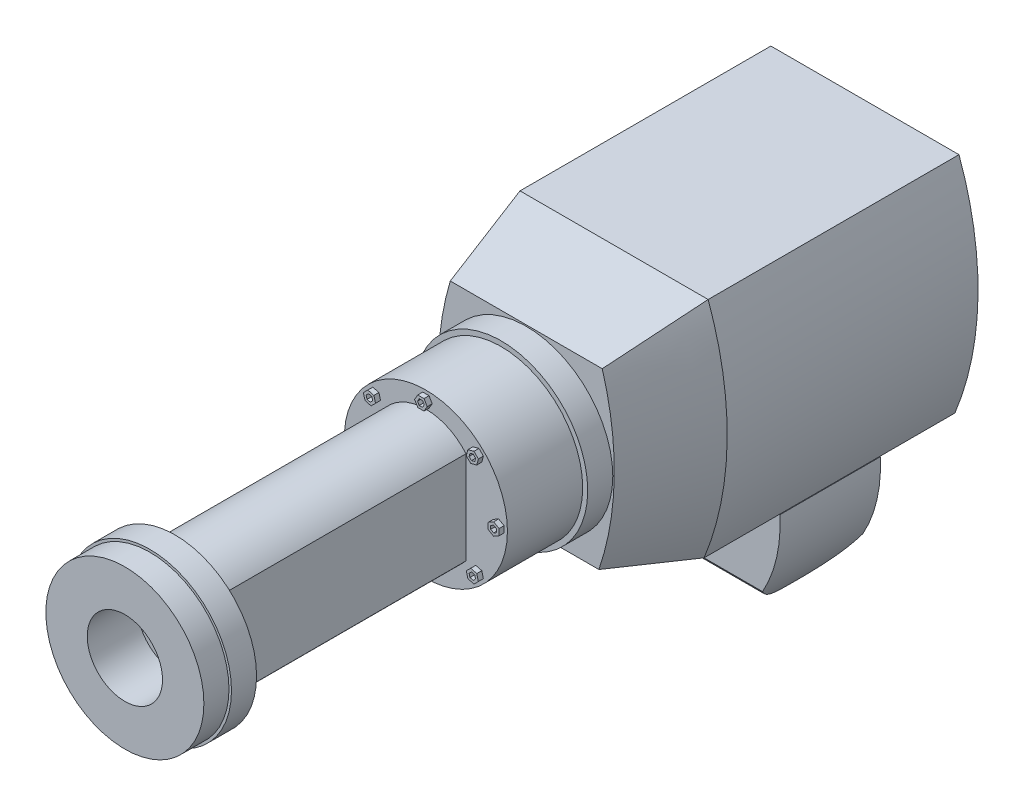
from build123d import *

# Parameters (mm, degrees)
BOSS_EXTRU_1_DEPTH           = 100
ESQUISSE4_R                  = 34.5
BOSS_EXTRU_2_DEPTH           = 10
ESQUISSE5_R                  = 32.5
BOSS_EXTRU_3_DEPTH           = 30
BOSS_EXTRU_4_DEPTH           = 2
R_P_TITION_START             = 175
R_P_TITION_CIRCULAIRE1_DEPTH = 2
BOSS_EXTRU_5_DEPTH           = 100
ESQUISSE8_R                  = 32.5
BOSS_EXTRU_6_DEPTH           = 10
ESQUISSE9_R                  = 31.5
BOSS_EXTRU_7_DEPTH           = 10
BOSS_EXTRU_8_DEPTH           = 21
BOSS_EXTRU_8_DEPTH_BACK      = 18
ESQUISSE11_R                 = 42.5
BOSS_EXTRU_9_DEPTH           = 35
BOSS_EXTRU_10_DEPTH          = 20
BOSS_EXTRU_10_DEPTH_BACK     = 20
ENL_V_MAT_EXTRU_1_DEPTH      = 317.476302481
ESQUISSE15_R                 = 15
ENL_V_MAT_EXTRU_2_DEPTH      = 20
ESQUISSE16_R                 = 15
ENL_V_MAT_EXTRU_3_DEPTH      = 20


# Read off the part's stored shape, not the designer's step: Répétition circulaire1
with BuildPart() as part:
    # Esquisse1 → Boss.-Extru.1 (new body)
    with BuildSketch(Plane.XY):
        with BuildLine():
            Line((-37.5, 45), (37.5, 45))
            ThreePointArc((37.5, 45), (45.075676523, -0.150274002), (35.886541902, -45))
            Line((35.886541902, -45), (-35.886541902, -45))
            ThreePointArc((-35.886541902, -45), (-45.075676523, -0.150274002), (-37.5, 45))
        make_face()
    extrude(amount=BOSS_EXTRU_1_DEPTH)

    # Esquisse2 for Lissage2 → Lissage2 section 0
    with BuildSketch(Plane.XY.offset(100)):
        with BuildLine():
            Line((-35.886541902, -45), (35.886541902, -45))
            # circular arc as an exact rational Bezier (weights 1, cos(half-angle), 1)
            Bezier((35.886541902, -45), (54.060708359, -0.311351473), (37.5, 45), weights=[1, 0.93292998, 1])
            Line((37.5, 45), (-37.5, 45))
            Bezier((-37.5, 45), (-54.060708359, -0.311351473), (-35.886541902, -45), weights=[1, 0.93292998, 1])
        make_face()
    # Esquisse3 for Lissage2 → Lissage2 section 1
    with BuildSketch(Plane.XY.offset(135)):
        with BuildLine():
            Line((30.286276797, 35), (-30.286276797, 35))
            Bezier((-30.286276797, 35), (-40.80320151, -0.213468414), (-28.950299615, -35), weights=[1, 0.952543259, 1])
            Line((-28.950299615, -35), (28.950299615, -35))
            Bezier((28.950299615, -35), (40.80320151, -0.213468414), (30.286276797, 35), weights=[1, 0.952543259, 1])
        make_face()
    loft()

    # Esquisse4 → Boss.-Extru.2 (add)
    with BuildSketch(Plane.XY.offset(135)):
        Circle(ESQUISSE4_R)
    extrude(amount=BOSS_EXTRU_2_DEPTH)

    # Esquisse5 → Boss.-Extru.3 (add)
    with BuildSketch(Plane.XY.offset(145)):
        Circle(ESQUISSE5_R)
    extrude(amount=BOSS_EXTRU_3_DEPTH)

    # Esquisse6 → Boss.-Extru.4 (add)
    with BuildSketch(Plane.XY.offset(175)):
        Polygon((31.165063509, 1.25), (29, 2.5), (26.834936491, 1.25), (26.834936491, -1.25), (29, -2.5), (31.165063509, -1.25), align=None)
        Polygon((29, 1.345299462), (27.834936491, 0.672649731), (27.834936491, -0.672649731), (29, -1.345299462), (30.165063509, -0.672649731), (30.165063509, 0.672649731), align=None, mode=Mode.SUBTRACT)
    extrude(amount=BOSS_EXTRU_4_DEPTH)

    # Répétition circulaire1 outline → Répétition circulaire1 (add)
    # profile 1 of 7: a face of its own
    with BuildSketch(Plane.XY.offset(R_P_TITION_START)):
        Polygon((22.92091122, 21.153144267), (21.153144267, 22.92091122), (18.738329701, 22.273863607), (18.091282089, 19.859049042), (19.859049042, 18.091282089), (22.273863607, 18.738329701), align=None)
        Polygon((19.20663716, 20.157907532), (19.554826282, 21.457367026), (20.854285776, 21.805556148), (21.805556148, 20.854285776), (21.457367026, 19.554826282), (20.157907532, 19.20663716), align=None, mode=Mode.SUBTRACT)
    # profile 2 of 7: a face of its own
    with BuildSketch(Plane.XY.offset(R_P_TITION_START)):
        Polygon((21.153144267, -22.92091122), (22.92091122, -21.153144267), (22.273863607, -18.738329701), (19.859049042, -18.091282089), (18.091282089, -19.859049042), (18.738329701, -22.273863607), align=None)
        Polygon((20.157907532, -19.20663716), (21.457367026, -19.554826282), (21.805556148, -20.854285776), (20.854285776, -21.805556148), (19.554826282, -21.457367026), (19.20663716, -20.157907532), align=None, mode=Mode.SUBTRACT)
    # profile 3 of 7: a face of its own
    with BuildSketch(Plane.XY.offset(R_P_TITION_START)):
        Polygon((-1.25, -31.165063509), (1.25, -31.165063509), (2.5, -29), (1.25, -26.834936491), (-1.25, -26.834936491), (-2.5, -29), align=None)
        Polygon((0.672649731, -27.834936491), (1.345299462, -29), (0.672649731, -30.165063509), (-0.672649731, -30.165063509), (-1.345299462, -29), (-0.672649731, -27.834936491), align=None, mode=Mode.SUBTRACT)
    # profile 4 of 7: a face of its own
    with BuildSketch(Plane.XY.offset(R_P_TITION_START)):
        Polygon((-22.92091122, -21.153144267), (-21.153144267, -22.92091122), (-18.738329701, -22.273863607), (-18.091282089, -19.859049042), (-19.859049042, -18.091282089), (-22.273863607, -18.738329701), align=None)
        Polygon((-19.20663716, -20.157907532), (-19.554826282, -21.457367026), (-20.854285776, -21.805556148), (-21.805556148, -20.854285776), (-21.457367026, -19.554826282), (-20.157907532, -19.20663716), align=None, mode=Mode.SUBTRACT)
    # profile 5 of 7: a face of its own
    with BuildSketch(Plane.XY.offset(R_P_TITION_START)):
        Polygon((-31.165063509, 1.25), (-31.165063509, -1.25), (-29, -2.5), (-26.834936491, -1.25), (-26.834936491, 1.25), (-29, 2.5), align=None)
        Polygon((-27.834936491, -0.672649731), (-29, -1.345299462), (-30.165063509, -0.672649731), (-30.165063509, 0.672649731), (-29, 1.345299462), (-27.834936491, 0.672649731), align=None, mode=Mode.SUBTRACT)
    # profile 6 of 7: a face of its own
    with BuildSketch(Plane.XY.offset(R_P_TITION_START)):
        Polygon((-21.153144267, 22.92091122), (-22.92091122, 21.153144267), (-22.273863607, 18.738329701), (-19.859049042, 18.091282089), (-18.091282089, 19.859049042), (-18.738329701, 22.273863607), align=None)
        Polygon((-20.157907532, 19.20663716), (-21.457367026, 19.554826282), (-21.805556148, 20.854285776), (-20.854285776, 21.805556148), (-19.554826282, 21.457367026), (-19.20663716, 20.157907532), align=None, mode=Mode.SUBTRACT)
    # profile 7 of 7: a face of its own
    with BuildSketch(Plane.XY.offset(R_P_TITION_START)):
        Polygon((1.25, 31.165063509), (-1.25, 31.165063509), (-2.5, 29), (-1.25, 26.834936491), (1.25, 26.834936491), (2.5, 29), align=None)
        Polygon((-0.672649731, 27.834936491), (-1.345299462, 29), (-0.672649731, 30.165063509), (0.672649731, 30.165063509), (1.345299462, 29), (0.672649731, 27.834936491), align=None, mode=Mode.SUBTRACT)
    extrude(amount=R_P_TITION_CIRCULAIRE1_DEPTH)

    # Esquisse7 → Boss.-Extru.5 (add)
    with BuildSketch(Plane.XY.offset(175)):
        with BuildLine():
            Line((16, -18.5), (16, 18.5))
            ThreePointArc((16, 18.5), (0, 25.898529491), (-16, 18.5))
            Line((-16, 18.5), (-16, -18.5))
            ThreePointArc((-16, -18.5), (0, -25.898529491), (16, -18.5))
        make_face()
    extrude(amount=BOSS_EXTRU_5_DEPTH)

    # Esquisse11 → Boss.-Extru.8 (add, two sides: drawn at the far end of the back side and taken through both)
    with BuildSketch(Plane(origin=(-35.886541902, 0, 0), x_dir=(0, 0, -1), z_dir=(1, 0, 0)).offset(-BOSS_EXTRU_8_DEPTH_BACK)):
        with Locations((-50, -45)):
            Circle(ESQUISSE11_R)
    extrude(amount=BOSS_EXTRU_8_DEPTH + BOSS_EXTRU_8_DEPTH_BACK)

    # Esquisse12 → Boss.-Extru.9 (add)
    with BuildSketch(Plane(origin=(-14.886541902, 0, 0), x_dir=(0, 0, -1), z_dir=(1, 0, 0))):
        with BuildLine():
            Line((-70, -45), (-70, -75))
            ThreePointArc((-70, -75), (-50, -85.128852225), (-30, -75))
            Line((-30, -75), (-30, -45))
            Line((-30, -45), (-70, -45))
        make_face()
    extrude(amount=BOSS_EXTRU_9_DEPTH)

    # Esquisse13 → Boss.-Extru.10 (add, two sides: drawn at the far end of the back side and taken through both)
    with BuildSketch(Plane.XY.offset(50).offset(-BOSS_EXTRU_10_DEPTH_BACK)):
        with BuildLine():
            Line((20.113458098, -45), (20.113458098, -87))
            ThreePointArc((20.113458098, -87), (32.599371533, -67.708919404), (36.113458098, -45))
            Line((36.113458098, -45), (20.113458098, -45))
        make_face()
    extrude(amount=BOSS_EXTRU_10_DEPTH + BOSS_EXTRU_10_DEPTH_BACK)

    # Esquisse14 → Enlèv. mat.-Extru.1 (cut, through all)
    with BuildSketch(Plane.ZY.offset(-20.113458098)):
        with BuildLine():
            Line((70, -75), (70, -87))
            Line((70, -87), (30, -87))
            Line((30, -87), (30, -75))
            ThreePointArc((30, -75), (50, -85.128852225), (70, -75))
        make_face()
    extrude(amount=-ENL_V_MAT_EXTRU_1_DEPTH, mode=Mode.SUBTRACT)

    # Esquisse16 → Enlèv. mat.-Extru.3 (cut)
    with BuildSketch(Plane.ZY.offset(53.886541902)):
        with Locations((50, -45)):
            Circle(ESQUISSE16_R)
    extrude(amount=-ENL_V_MAT_EXTRU_3_DEPTH, mode=Mode.SUBTRACT)


with BuildPart() as body_2:
    # Esquisse8 → Boss.-Extru.6 (new body)
    with BuildSketch(Plane.XY.offset(275)):
        Circle(ESQUISSE8_R)
    extrude(amount=BOSS_EXTRU_6_DEPTH)

    # Esquisse9 → Boss.-Extru.7 (add)
    with BuildSketch(Plane.XY.offset(285)):
        Circle(ESQUISSE9_R)
    extrude(amount=BOSS_EXTRU_7_DEPTH)

    # Esquisse15 → Enlèv. mat.-Extru.2 (cut)
    with BuildSketch(Plane.XY.offset(295)):
        Circle(ESQUISSE15_R)
    extrude(amount=-ENL_V_MAT_EXTRU_2_DEPTH, mode=Mode.SUBTRACT)


solid = Compound([part.part, body_2.part])
